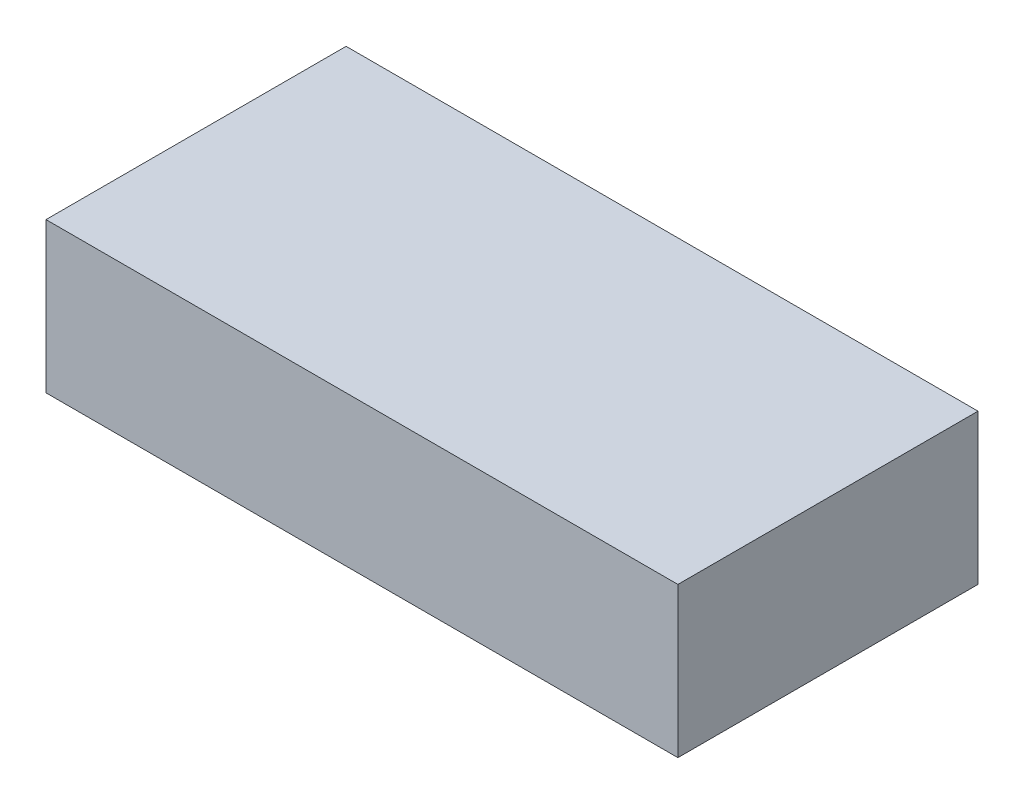
from build123d import *

# Parameters (mm, degrees)
SKETCH1_W           = 75.946
SKETCH1_H           = 36.068
BOSS_EXTRUDE1_DEPTH = 18.034


with BuildPart() as part:
    # Sketch1 → Boss-Extrude1 (new body)
    with BuildSketch(Plane(origin=(0, 0, 0), x_dir=(1, 0, 0), z_dir=(0, 1, 0))):
        Rectangle(SKETCH1_W, SKETCH1_H)
    extrude(amount=BOSS_EXTRUDE1_DEPTH)


solid = part.part
